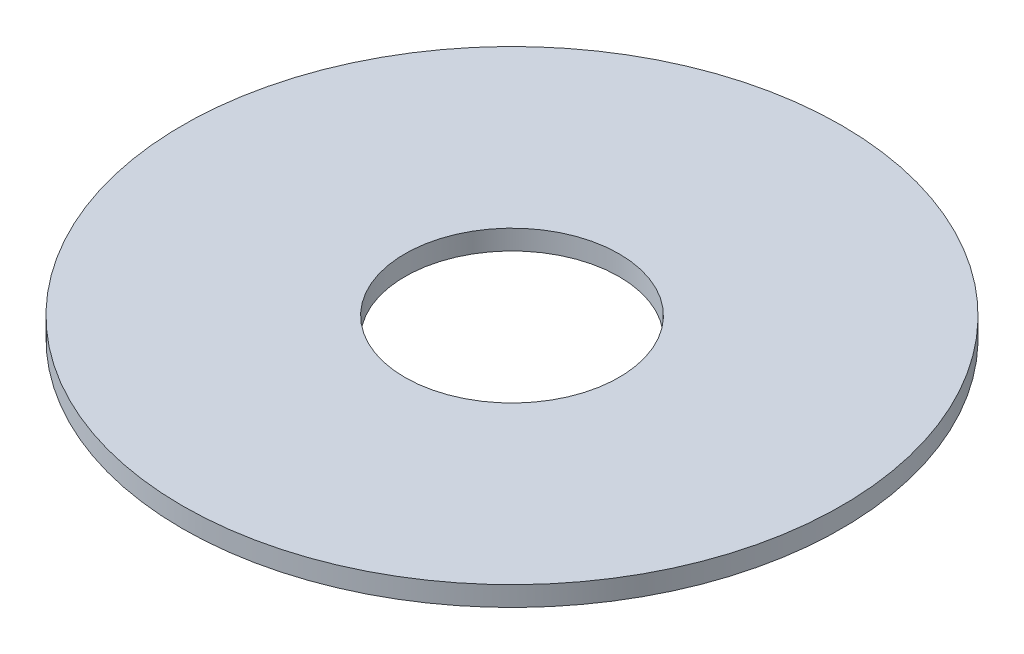
from build123d import *

# Parameters (mm, degrees)
SKETCH1_R           = 100
BOSS_EXTRUDE1_DEPTH = 6
SKETCH2_R           = 32.5
CUT_EXTRUDE1_DEPTH  = 142.548578234


with BuildPart() as part:
    # Sketch1 → Boss-Extrude1 (new body)
    with BuildSketch(Plane(origin=(0, 0, 0), x_dir=(1, 0, 0), z_dir=(0, 1, 0))):
        Circle(SKETCH1_R)
    extrude(amount=BOSS_EXTRUDE1_DEPTH)

    # Sketch2 → Cut-Extrude1 (cut, through all)
    with BuildSketch(Plane(origin=(0, 0, 0), x_dir=(1, 0, 0), z_dir=(0, 1, 0))):
        Circle(SKETCH2_R)
    extrude(amount=CUT_EXTRUDE1_DEPTH, mode=Mode.SUBTRACT)


solid = part.part
